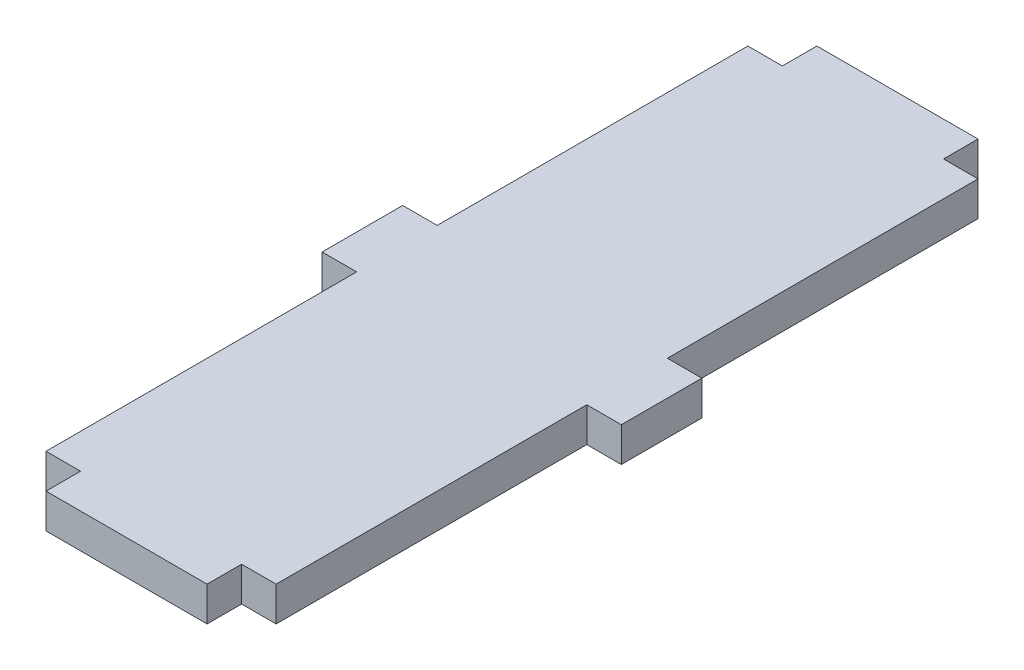
from build123d import *

# Parameters (mm, degrees)
SALIENTE_EXTRUIR1_DEPTH = 3


with BuildPart() as part:
    # Croquis2 → Saliente-Extruir1 (new body)
    with BuildSketch(Plane(origin=(0, 0, 0), x_dir=(1, 0, 0), z_dir=(0, 1, 0))):
        Polygon((-1.5, 22), (-4.5, 22), (-4.5, 15), (-1.5, 15), (-1.5, -12), (1.5, -12), (1.5, -15), (15.5, -15), (15.5, -12), (18.5, -12), (18.5, 15), (21.5, 15), (21.5, 22), (18.5, 22), (18.5, 49), (15.5, 49), (15.5, 52), (1.5, 52), (1.5, 49), (-1.5, 49), align=None)
    extrude(amount=SALIENTE_EXTRUIR1_DEPTH)


solid = part.part
